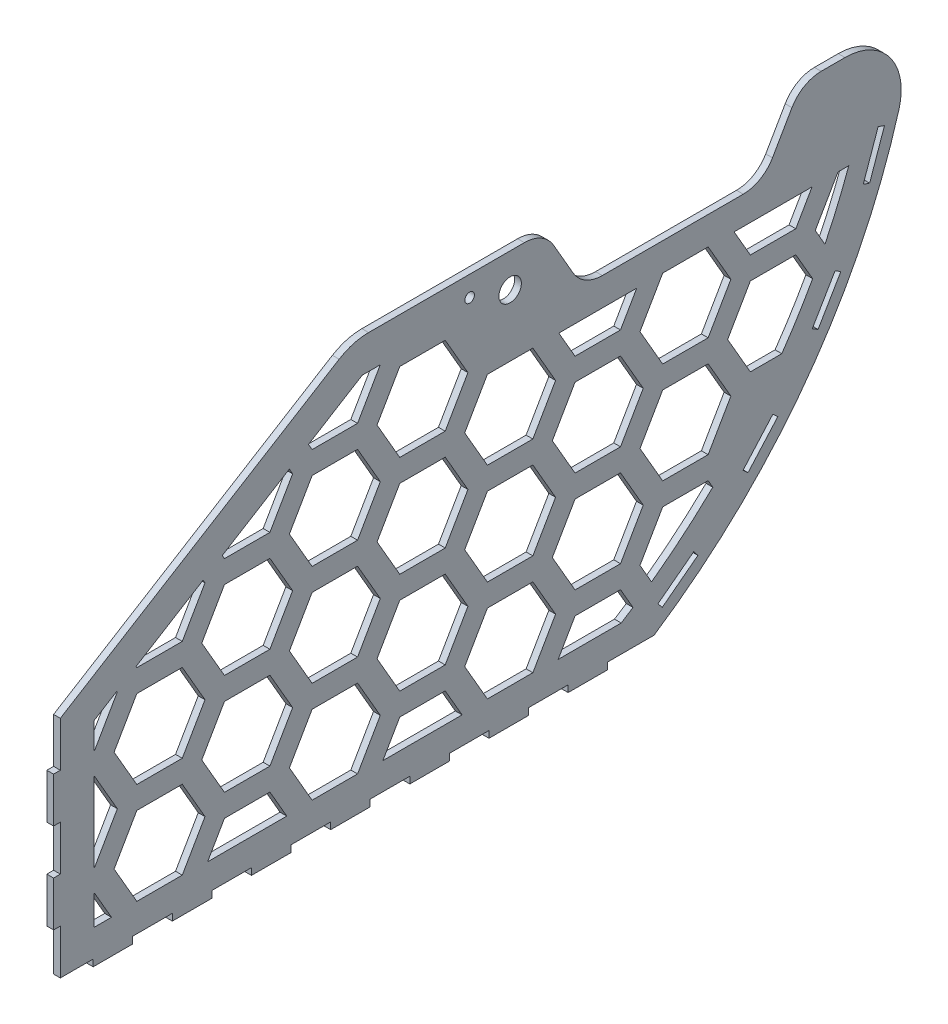
from build123d import *

# Parameters (mm, degrees)
BOSS_EXTRUDE1_DEPTH     = 1.5
CUT_EXTRUDE2_DEPTH      = 215.259188834
CUT_EXTRUDE2_DEPTH_BACK = 215.259188834
FILLET1_R               = 25
CUT_EXTRUDE3_DEPTH      = 215.259188834
CUT_EXTRUDE3_DEPTH_BACK = 215.259188834
SKETCH4_R               = 5
SKETCH4_R_2             = 2.15
CUT_EXTRUDE5_DEPTH      = 215.259188834
CUT_EXTRUDE5_DEPTH_BACK = 215.259188834
CUT_EXTRUDE1_DEPTH      = 215.243436306
CUT_EXTRUDE1_DEPTH_BACK = 215.243436306
FILLET2_R               = 15


with BuildPart() as part:
    # Sketch1 → Boss-Extrude1 (new, symmetric)
    with BuildSketch(Plane(origin=(0, 0, 0), x_dir=(0, 0, -1), z_dir=(1, 0, 0))):
        with BuildLine():
            Line((-190, -70), (-190, -90))
            Line((-190, -90), (-175.4, -90))
            Line((-175.4, -90), (-175.4, -93))
            Line((-175.4, -93), (-157.8, -93))
            Line((-157.8, -93), (-157.8, -90))
            Line((-157.8, -90), (-140.2, -90))
            Line((-140.2, -90), (-140.2, -93))
            Line((-140.2, -93), (-122.6, -93))
            Line((-122.6, -93), (-122.6, -90))
            Line((-122.6, -90), (-105, -90))
            Line((-105, -90), (-105, -93))
            Line((-105, -93), (-87.4, -93))
            Line((-87.4, -93), (-87.4, -90))
            Line((-87.4, -90), (-69.8, -90))
            Line((-69.8, -90), (-69.8, -93))
            Line((-69.8, -93), (-52.2, -93))
            Line((-52.2, -93), (-52.2, -90))
            Line((-52.2, -90), (-34.6, -90))
            Line((-34.6, -90), (-34.6, -93))
            Line((-34.6, -93), (-17, -93))
            Line((-17, -93), (-17, -90))
            Line((-17, -90), (0.6, -90))
            Line((0.6, -90), (0.6, -93))
            Line((0.6, -93), (18.2, -93))
            Line((18.2, -93), (18.2, -90))
            Line((18.2, -90), (35.8, -90))
            Line((35.8, -90), (35.8, -93))
            Line((35.8, -93), (53.4, -93))
            Line((53.4, -93), (53.4, -90))
            Line((53.4, -90), (74, -90))
            ThreePointArc((74, -90), (150.972525184, -12.226738452), (190, 90))
            Line((190, 90), (-60, 90))
            Line((-60, 90), (-190, 10))
            Line((-190, 10), (-190, -10))
            Line((-190, -10), (-193, -10))
            Line((-193, -10), (-193, -30))
            Line((-193, -30), (-190, -30))
            Line((-190, -30), (-190, -50))
            Line((-190, -50), (-193, -50))
            Line((-193, -50), (-193, -70))
            Line((-193, -70), (-190, -70))
        make_face()
    extrude(amount=BOSS_EXTRUDE1_DEPTH, both=True)

    # Sketch3 → Cut-Extrude2 (cut, two sides: drawn at the far end of the back side and taken through both)
    with BuildSketch(Plane(origin=(1.5, 0, 0), x_dir=(0, 0, -1), z_dir=(1, 0, 0)).offset(-CUT_EXTRUDE2_DEPTH_BACK)):
        Polygon((144.336191615, -7.191110963), (154.464917258, 10.054436777), (157.051749419, 8.535127931), (146.923023776, -8.710419809), align=None)
        Polygon((169.845423163, 36.138487445), (176.458034034, 55.013692808), (173.62675323, 56.005584438), (167.014142358, 37.130379076), align=None)
        Polygon((115.781435018, -48.296557852), (129.04597098, -33.328188344), (126.800715553, -31.33850795), (113.536179592, -46.306877458), align=None)
        Polygon((75.770557963, -78.748236125), (91.672859151, -66.619063979), (93.492234972, -69.004409157), (77.589933785, -81.133581303), align=None)
    extrude(amount=CUT_EXTRUDE2_DEPTH + CUT_EXTRUDE2_DEPTH_BACK, mode=Mode.SUBTRACT)

    # Fillet1
    fillet1_edges = [part.edges().sort_by_distance(p)[0] for p in [
        (0, 90, -190),
        (0, 90, 60),
    ]]
    fillet(fillet1_edges, radius=FILLET1_R)

    # Sketch4 → Cut-Extrude3 (cut, two sides: drawn at the far end of the back side and taken through both)
    with BuildSketch(Plane(origin=(1.5, 0, 0), x_dir=(0, 0, -1), z_dir=(1, 0, 0)).offset(-CUT_EXTRUDE3_DEPTH_BACK)):
        with Locations((10, 75)):
            Circle(SKETCH4_R)
        with Locations((-8, 81)):
            Circle(SKETCH4_R_2)
    extrude(amount=CUT_EXTRUDE3_DEPTH + CUT_EXTRUDE3_DEPTH_BACK, mode=Mode.SUBTRACT)

    # Sketch5 → Cut-Extrude5 (cut, two sides: drawn at the far end of the back side and taken through both)
    with BuildSketch(Plane(origin=(1.5, 0, 0), x_dir=(0, 0, -1), z_dir=(1, 0, 0)).offset(-CUT_EXTRUDE5_DEPTH_BACK)):
        Polygon((-359.656483714, 756.244573254), (25, 90), (42.320508076, 60), (122.320508076, 60), (139.641016151, 90), (524.297499866, 756.244573254), (524.297499866, 2294.870508111), (-359.656483714, 2294.870508111), align=None)
    extrude(amount=CUT_EXTRUDE5_DEPTH + CUT_EXTRUDE5_DEPTH_BACK, mode=Mode.SUBTRACT)

    # Sketch2 → Cut-Extrude1 (cut, two sides: drawn at the far end of the back side and taken through both)
    with BuildSketch(Plane(origin=(0, 0, 0), x_dir=(0, 0, -1), z_dir=(1, 0, 0)).offset(-CUT_EXTRUDE1_DEPTH_BACK)):
        Polygon((-86.706170089, -37.5), (-96.8097998, -20), (-117.017059222, -20), (-127.120688933, -37.5), (-117.017059222, -55), (-96.8097998, -55), align=None)
        Polygon((-89.304246301, -78), (-96.8097998, -65), (-117.017059222, -65), (-124.522612721, -78), align=None)
        Polygon((144.233937587, 47.5), (109.592921435, 47.5), (116.8097998, 35), (137.017059222, 35), align=None)
        Polygon((98.045916051, 47.5), (77.83865663, 47.5), (67.735026919, 30), (77.83865663, 12.5), (98.045916051, 12.5), (108.149545762, 30), align=None)
        Polygon((-39.074772881, -65), (-46.580326381, -78), (-11.36195996, -78), (-18.867513459, -65), align=None)
        Polygon((-175, -78), (-167.246532641, -78), (-174.752086141, -65), (-175, -65), align=None)
        with BuildLine():
            Line((38.867513459, -65), (31.36195996, -78))
            Line((31.36195996, -78), (59.38374925, -78))
            ThreePointArc((59.38374925, -78), (62.016443005, -76.325605051), (64.627797507, -74.618120787))
            Line((64.627797507, -74.618120787), (59.074772881, -65))
            Line((59.074772881, -65), (38.867513459, -65))
        make_face()
        Polygon((-175, -20), (-175, -55), (-174.752086141, -55), (-164.64845643, -37.5), (-174.752086141, -20), align=None)
        with BuildLine():
            Line((67.735026919, -60), (72.876654683, -68.905560522))
            ThreePointArc((72.876654683, -68.905560522), (86.902034031, -57.976446124), (100.105659722, -46.067580688))
            Line((100.105659722, -46.067580688), (98.045916051, -42.5))
            Line((98.045916051, -42.5), (77.83865663, -42.5))
            Line((77.83865663, -42.5), (67.735026919, -60))
        make_face()
        Polygon((-175, 1.618072089), (-175, -10), (-174.752086141, -10), (-164.64845643, 7.5), (-164.856450543, 7.860256371), align=None)
        Polygon((-126.516737714, 31.453925804), (-156.336514358, 13.103294023), (-155.988202392, 12.5), (-135.78094297, 12.5), (-125.67731326, 30), align=None)
        with BuildLine():
            Line((116.8097998, -10), (130.796061381, -10))
            ThreePointArc((130.796061381, -10), (137.939536134, 0.835668139), (144.504562503, 12.031263895))
            Line((144.504562503, 12.031263895), (137.017059222, 25))
            Line((137.017059222, 25), (116.8097998, 25))
            Line((116.8097998, 25), (106.706170089, 7.5))
            Line((106.706170089, 7.5), (116.8097998, -10))
        make_face()
        Polygon((-88.177024885, 55.047595237), (-117.99680153, 36.696963456), (-117.017059222, 35), (-96.8097998, 35), (-86.706170089, 52.5), align=None)
        with BuildLine():
            Line((145.67731326, 30), (149.980597418, 22.546493198))
            ThreePointArc((149.980597418, 22.546493198), (155.617075262, 34.878023967), (160.569070277, 47.5))
            Line((160.569070277, 47.5), (155.78094297, 47.5))
            Line((155.78094297, 47.5), (145.67731326, 30))
        make_face()
        Polygon((-55.754367145, 75), (-79.657088701, 60.290632889), (-78.045916051, 57.5), (-57.83865663, 57.5), (-47.735026919, 75), align=None)
        Polygon((66.291651246, 47.5), (31.650635095, 47.5), (38.867513459, 35), (59.074772881, 35), align=None)
        Polygon((-78.045916051, -42.5), (-88.149545762, -60), (-78.045916051, -77.5), (-57.83865663, -77.5), (-47.735026919, -60), (-57.83865663, -42.5), align=None)
        Polygon((-86.706170089, 7.5), (-96.8097998, 25), (-117.017059222, 25), (-127.120688933, 7.5), (-117.017059222, -10), (-96.8097998, -10), align=None)
        Polygon((-78.045916051, 2.5), (-88.149545762, -15), (-78.045916051, -32.5), (-57.83865663, -32.5), (-47.735026919, -15), (-57.83865663, 2.5), align=None)
        Polygon((-78.045916051, 47.5), (-88.149545762, 30), (-78.045916051, 12.5), (-57.83865663, 12.5), (-47.735026919, 30), (-57.83865663, 47.5), align=None)
        Polygon((-8.763883749, 52.5), (-18.867513459, 70), (-39.074772881, 70), (-49.178402592, 52.5), (-39.074772881, 35), (-18.867513459, 35), align=None)
        Polygon((-8.763883749, 7.5), (-18.867513459, 25), (-39.074772881, 25), (-49.178402592, 7.5), (-39.074772881, -10), (-18.867513459, -10), align=None)
        Polygon((-0.103629711, 2.5), (-10.207259422, -15), (-0.103629711, -32.5), (20.103629711, -32.5), (30.207259422, -15), (20.103629711, 2.5), align=None)
        Polygon((-8.763883749, -37.5), (-18.867513459, -20), (-39.074772881, -20), (-49.178402592, -37.5), (-39.074772881, -55), (-18.867513459, -55), align=None)
        Polygon((-0.103629711, -42.5), (-10.207259422, -60), (-0.103629711, -77.5), (20.103629711, -77.5), (30.207259422, -60), (20.103629711, -42.5), align=None)
        Polygon((-0.103629711, 47.5), (-10.207259422, 30), (-0.103629711, 12.5), (20.103629711, 12.5), (30.207259422, 30), (20.103629711, 47.5), align=None)
        Polygon((69.178402592, 7.5), (59.074772881, 25), (38.867513459, 25), (28.763883749, 7.5), (38.867513459, -10), (59.074772881, -10), align=None)
        Polygon((77.83865663, 2.5), (67.735026919, -15), (77.83865663, -32.5), (98.045916051, -32.5), (108.149545762, -15), (98.045916051, 2.5), align=None)
        Polygon((69.178402592, -37.5), (59.074772881, -20), (38.867513459, -20), (28.763883749, -37.5), (38.867513459, -55), (59.074772881, -55), align=None)
        Polygon((-155.988202392, 2.5), (-166.091832103, -15), (-155.988202392, -32.5), (-135.78094297, -32.5), (-125.67731326, -15), (-135.78094297, 2.5), align=None)
        Polygon((-155.988202392, -42.5), (-166.091832103, -60), (-155.988202392, -77.5), (-135.78094297, -77.5), (-125.67731326, -60), (-135.78094297, -42.5), align=None)
    extrude(amount=CUT_EXTRUDE1_DEPTH + CUT_EXTRUDE1_DEPTH_BACK, mode=Mode.SUBTRACT)

    # Fillet2
    fillet2_edges = [part.edges().sort_by_distance(p)[0] for p in [
        (0, 60, -122.320508076),
        (0, 60, -42.320508076),
        (0, 90, -25),
        (0, 90, -139.641016151),
    ]]
    fillet(fillet2_edges, radius=FILLET2_R)


solid = part.part
